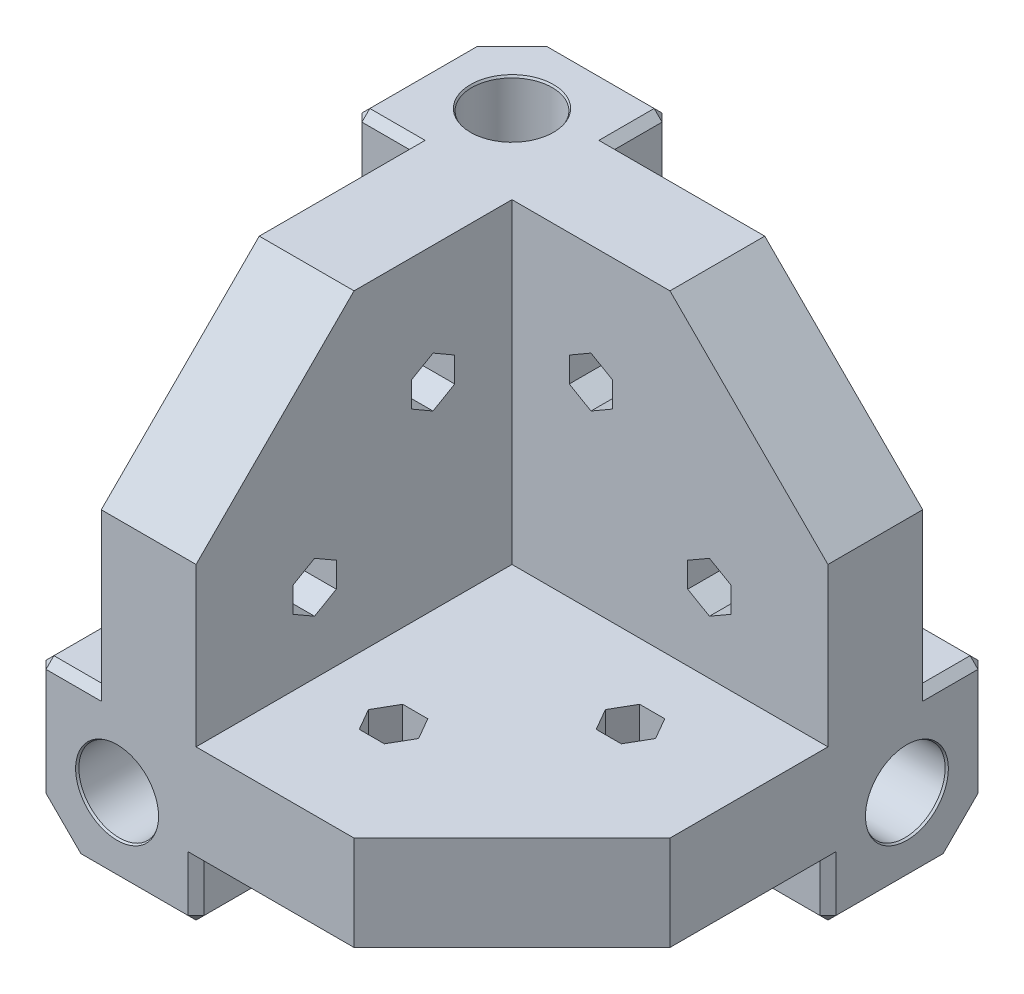
from build123d import *

# Parameters (mm, degrees)
BASE_SHAPE_BASE_DEPTH        = 20
BASE_SHAPE_EXTENSION_DEPTH   = 40
BASE_SHAPE_FINISH_SKETCH_W   = 12
BASE_SHAPE_FINISH_SKETCH_H   = 40
BASE_SHAPE_WALL_DEPTH        = 40
ROD_HOLE_D10_Z_D             = 10.2
ROD_HOLE_D10_Z_DEPTH         = 40
ROD_HOLE_D10_Z_CSINK_D       = 10.5
ROD_HOLE_D10_Z_CSINK_ANGLE   = 60
ROD_HOLE_D10_X_D             = 10.2
ROD_HOLE_D10_X_DEPTH         = 40
ROD_HOLE_D10_X_CSINK_D       = 10.5
ROD_HOLE_D10_X_CSINK_ANGLE   = 60
ROD_HOLE_D10_Y_D             = 10.2
ROD_HOLE_D10_Y_DEPTH         = 40
ROD_HOLE_D10_Y_CSINK_D       = 10.5
ROD_HOLE_D10_Y_CSINK_ANGLE   = 60
OUTER_CHAMFERS_SIZE          = 5
INNER_SMALLER_CHAMFERS_SIZE  = 1
LARGE_CHAMFERS_SIZE          = 20
HULL_PART_HOLES_M3_START     = 8
HULL_PART_HOLES_M3_OUTLINE_R = 1.7
HULL_PART_HOLES_M3_DEPTH     = 12
HULL_PART_NUT_HOLE_DEPTH     = 5


# Read off the part's stored shape, not the designer's step: hull_part_holes_m3
with BuildPart() as part:
    # base_shape_sketch → base_shape_base (new body)
    with BuildSketch(Plane.XY):
        Polygon((0, 0), (60, 0), (60, 20), (20, 20), (20, 60), (0, 60), align=None)
    extrude(amount=BASE_SHAPE_BASE_DEPTH)

    # base_shape_extension_sketch → base_shape_extension (add)
    with BuildSketch(Plane.XY.offset(20)):
        Polygon((20, 60), (20, 20), (60, 20), (60, 8), (20, 8), (20, 0), (0, 0), (0, 20), (8, 20), (8, 60), align=None)
    extrude(amount=BASE_SHAPE_EXTENSION_DEPTH)

    # base_shape_finish_sketch → base_shape_wall (add)
    with BuildSketch(Plane(origin=(20, 0, 0), x_dir=(0, 0, -1), z_dir=(1, 0, 0))):
        with Locations((-14, 40)):
            Rectangle(BASE_SHAPE_FINISH_SKETCH_W, BASE_SHAPE_FINISH_SKETCH_H)
    extrude(amount=BASE_SHAPE_WALL_DEPTH)

    # rod_hole_d10_z
    with Locations(Plane.XY.offset(60)):
        with Locations((10, 10)):
            CounterSinkHole(ROD_HOLE_D10_Z_D / 2, ROD_HOLE_D10_Z_CSINK_D / 2, depth=ROD_HOLE_D10_Z_DEPTH, counter_sink_angle=ROD_HOLE_D10_Z_CSINK_ANGLE)

    # rod_hole_d10_x
    with Locations(Plane(origin=(60, 0, 0), x_dir=(0, 0, -1), z_dir=(1, 0, 0))):
        with Locations((-10, 10)):
            CounterSinkHole(ROD_HOLE_D10_X_D / 2, ROD_HOLE_D10_X_CSINK_D / 2, depth=ROD_HOLE_D10_X_DEPTH, counter_sink_angle=ROD_HOLE_D10_X_CSINK_ANGLE)

    # rod_hole_d10_y
    with Locations(Plane(origin=(0, 60, 0), x_dir=(1, 0, 0), z_dir=(0, 1, 0))):
        with Locations((10, -10)):
            CounterSinkHole(ROD_HOLE_D10_Y_D / 2, ROD_HOLE_D10_Y_CSINK_D / 2, depth=ROD_HOLE_D10_Y_DEPTH, counter_sink_angle=ROD_HOLE_D10_Y_CSINK_ANGLE)

    # outer_chamfers
    outer_chamfers_edges = [part.edges().sort_by_distance(p)[0] for p in [
        (0, 0, 30),
        (30, 0, 0),
        (0, 30, 0),
    ]]
    chamfer(outer_chamfers_edges, length=OUTER_CHAMFERS_SIZE)

    # inner_smaller_chamfers
    inner_smaller_chamfers_edges = [part.edges().sort_by_distance(p)[0] for p in [
        (0, 60, 12.5),
        (60, 0, 12.5),
        (60, 4, 20),
        (40, 0, 20),
        (4, 60, 20),
        (0, 20, 40),
        (20, 0, 40),
        (4, 20, 60),
        (0, 12.5, 60),
        (20, 4, 60),
        (20, 60, 4),
        (0, 40, 20),
        (60, 20, 4),
        (12.5, 60, 0),
        (20, 40, 0),
        (40, 20, 0),
        (12.5, 0, 60),
        (2.5, 2.5, 60),
        (60, 12.5, 0),
        (60, 2.5, 2.5),
        (2.5, 60, 2.5),
    ]]
    chamfer(inner_smaller_chamfers_edges, length=INNER_SMALLER_CHAMFERS_SIZE)

    # large_chamfers
    large_chamfers_edges = [part.edges().sort_by_distance(p)[0] for p in [
        (14, 60, 60),
        (60, 14, 60),
        (60, 60, 14),
    ]]
    chamfer(large_chamfers_edges, length=LARGE_CHAMFERS_SIZE)

    # hull_part_holes_m3 outline → hull_part_holes_m3 (cut)
    with BuildSketch(Plane.YZ.offset(HULL_PART_HOLES_M3_START)):
        with Locations((45, 30)):
            Circle(HULL_PART_HOLES_M3_OUTLINE_R)
        with Locations((30, 45)):
            Circle(HULL_PART_HOLES_M3_OUTLINE_R)
    hull_part_holes_m3 = extrude(amount=HULL_PART_HOLES_M3_DEPTH, mode=Mode.SUBTRACT)

    # Sketch12 → hull_part_nut_hole (cut)
    with BuildSketch(Plane(origin=(20, 0, 0), x_dir=(0, 0, -1), z_dir=(1, 0, 0))):
        Polygon((-30, 48.175426481), (-32.75, 46.58771324), (-32.75, 43.41228676), (-30, 41.824573519), (-27.25, 43.41228676), (-27.25, 46.58771324), align=None)
        Polygon((-45, 33.175426481), (-47.75, 31.58771324), (-47.75, 28.41228676), (-45, 26.824573519), (-42.25, 28.41228676), (-42.25, 31.58771324), align=None)
    hull_part_nut_hole = extrude(amount=-HULL_PART_NUT_HOLE_DEPTH, mode=Mode.SUBTRACT)

    # hull_part_holes_mirror_x: hull_part_holes_m3, hull_part_nut_hole across plane
    add(hull_part_holes_m3.mirror(Plane(origin=(0, 0, 0), x_dir=(0.7071067811865482, 0, 0.7071067811865468), z_dir=(-0.707106781186547, 0, 0.7071067811865481))), mode=Mode.SUBTRACT)
    add(hull_part_nut_hole.mirror(Plane(origin=(0, 0, 0), x_dir=(0.7071067811865482, 0, 0.7071067811865468), z_dir=(-0.707106781186547, 0, 0.7071067811865481))), mode=Mode.SUBTRACT)

    # hull_part_holes_mirror_y: hull_part_holes_m3, hull_part_nut_hole across plane
    add(hull_part_holes_m3.mirror(Plane(origin=(0, 0, 0), x_dir=(0, 0, 1), z_dir=(-0.7071067811865482, 0.7071067811865469, 0))), mode=Mode.SUBTRACT)
    add(hull_part_nut_hole.mirror(Plane(origin=(0, 0, 0), x_dir=(0, 0, 1), z_dir=(-0.7071067811865482, 0.7071067811865469, 0))), mode=Mode.SUBTRACT)


solid = part.part
